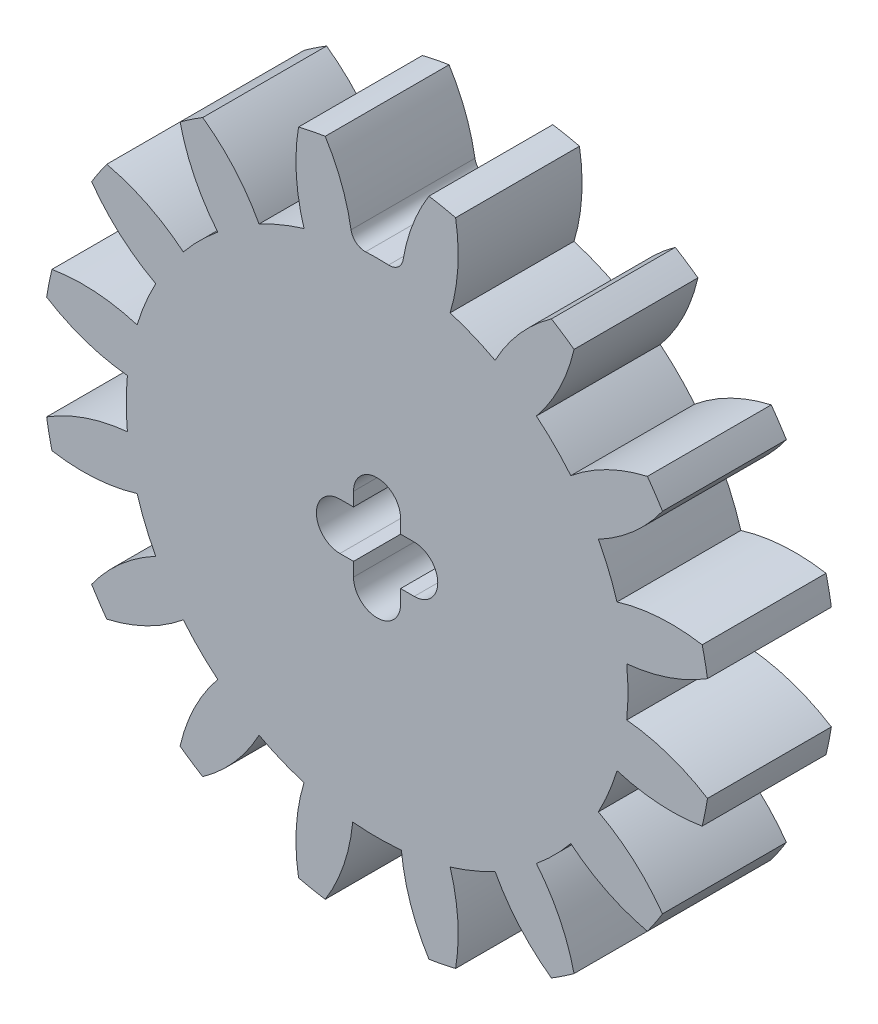
from build123d import *

# Parameters (mm, degrees)
SKETCH1_R           = 13.5
BOSS_EXTRUDE1_DEPTH = 2.5
CUT_EXTRUDE1_DEPTH  = 20.254869514
FILLET1_R           = 0.57
CIRPATTERN3_COUNT   = 16


with BuildPart() as part:
    # Sketch1 → Boss-Extrude1 (new, symmetric)
    with BuildSketch(Plane.XY):
        Circle(SKETCH1_R)
        with BuildLine():
            ThreePointArc((0.95, -1.5), (0, -2.45), (-0.95, -1.5))
            Line((-0.95, -1.5), (-0.95, -0.95))
            Line((-0.95, -0.95), (-1.5, -0.95))
            ThreePointArc((-1.5, -0.95), (-2.45, 0), (-1.5, 0.95))
            Line((-1.5, 0.95), (-0.95, 0.95))
            Line((-0.95, 0.95), (-0.95, 1.5))
            ThreePointArc((-0.95, 1.5), (0, 2.45), (0.95, 1.5))
            Line((0.95, 1.5), (0.95, 0.95))
            Line((0.95, 0.95), (1.5, 0.95))
            ThreePointArc((1.5, 0.95), (2.45, 0), (1.5, -0.95))
            Line((1.5, -0.95), (0.95, -0.95))
            Line((0.95, -0.95), (0.95, -1.5))
        make_face(mode=Mode.SUBTRACT)
    extrude(amount=BOSS_EXTRUDE1_DEPTH, both=True)

    # Sketch2 → Cut-Extrude1 (cut, symmetric)
    with BuildSketch(Plane.XY):
        with BuildLine():
            ThreePointArc((0.982234387, 10.077243701), (0, 10.125), (-0.982234387, 10.077243701))
            ThreePointArc((-0.982234387, 10.077243701), (-1.348268622, 11.771504161), (-2.092826994, 13.336794037))
            ThreePointArc((-2.092826994, 13.336794037), (0, 13.5), (2.092826994, 13.336794037))
            ThreePointArc((2.092826994, 13.336794037), (1.348268622, 11.771504161), (0.982234387, 10.077243701))
        make_face()
    cut_extrude1 = extrude(amount=CUT_EXTRUDE1_DEPTH, both=True, mode=Mode.SUBTRACT)

    # Fillet1
    fillet1_edges = [part.edges().sort_by_distance(p)[0] for p in [
        (0.982234387, 10.077243701, 0),
        (-0.982234387, 10.077243701, 0),
    ]]
    fillet(fillet1_edges, radius=FILLET1_R)

    # CirPattern3: Cut-Extrude1 ×16 about axis
    cirpattern3_axis = Axis((0, 0, 2.5), (0, 0, -1))
    for i in range(1, CIRPATTERN3_COUNT):
        add(cut_extrude1.rotate(cirpattern3_axis, i * 360 / CIRPATTERN3_COUNT), mode=Mode.SUBTRACT)


solid = part.part
